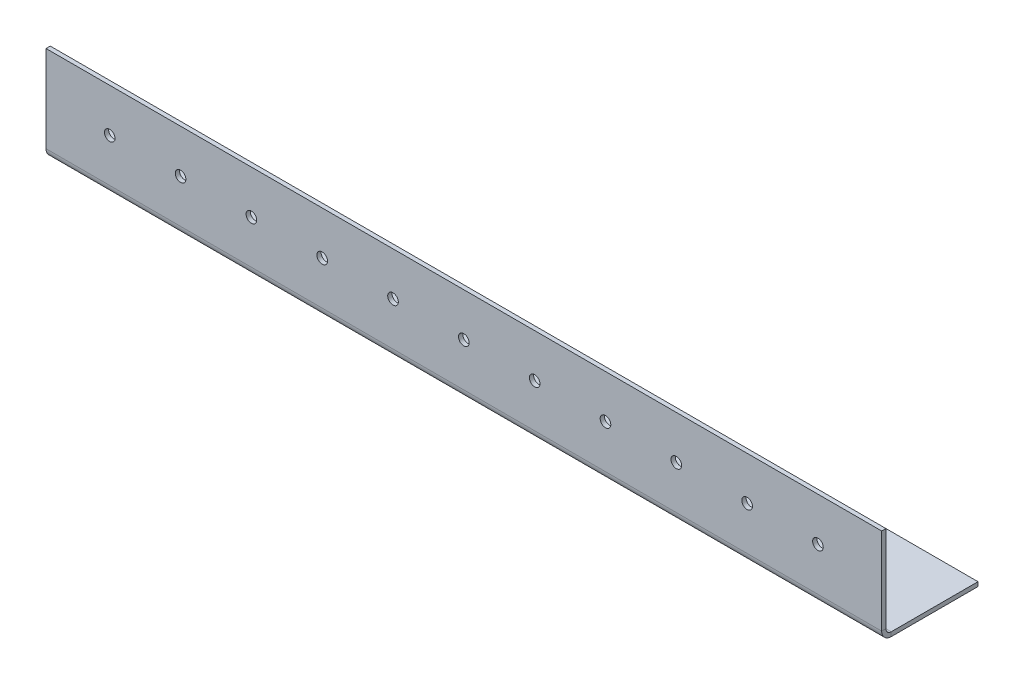
from build123d import *

# Parameters (mm, degrees)
SKETCH1_W                    = 236
SKETCH1_H                    = 26
BASE_FLANGE1_DEPTH           = 1.2
EDGE_FLANGE1_STRIP_W         = 7.8
EDGE_FLANGE1_STRIP_H         = 1.2
EDGE_FLANGE1_STRIP_CUT_DEPTH = 236
EDGE_FLANGE1_DEPTH           = 236
SKETCH9_R                    = 1.5
CUT_EXTRUDE1_DEPTH           = 10
SKETCH10_R                   = 1.5
CUT_EXTRUDE2_DEPTH           = 10


# Sheet-metal steps are written as plain solids
with BuildPart() as part:
    # Sketch1 → Base-Flange1 (new body)
    with BuildSketch(Plane(origin=(0, 0, 0), x_dir=(1, 0, 0), z_dir=(0, 1, 0))):
        with Locations((0, 13)):
            Rectangle(SKETCH1_W, SKETCH1_H)
    extrude(amount=-BASE_FLANGE1_DEPTH)

    # Edge-Flange1 strip (across the edge) → Edge-Flange1 strip cut (cut)
    with BuildSketch(Plane(origin=(-118, 0, 0), x_dir=(0, 0, -1), z_dir=(1, 0, 0))):
        with Locations((-2.4, -0.6)):
            Rectangle(EDGE_FLANGE1_STRIP_W, EDGE_FLANGE1_STRIP_H)
    extrude(amount=EDGE_FLANGE1_STRIP_CUT_DEPTH, mode=Mode.SUBTRACT)

    # Edge-Flange1 section (across the edge) → Edge-Flange1 (add)
    with BuildSketch(Plane(origin=(-118, 0, 0), x_dir=(0, 0, -1), z_dir=(1, 0, 0))):
        with BuildLine():
            Line((-1.2, 1.5), (-1.2, 26))
            Line((-1.2, 26), (0, 26))
            Line((0, 26), (0, 1.5))
            ThreePointArc((0, 1.5), (0.439339828, 0.439339828), (1.5, 0))
            Line((1.5, 0), (1.5, -1.2))
            ThreePointArc((1.5, -1.2), (-0.409188309, -0.409188309), (-1.2, 1.5))
        make_face()
    extrude(amount=EDGE_FLANGE1_DEPTH)

    # Sketch9 → Cut-Extrude1 (cut)
    with BuildSketch(Plane.XZ.offset(1.2)):
        with Locations(Location((-100, -13.75, 0), (0, 0, 270))):
            Circle(SKETCH9_R)
        with Locations(Location((-80, -13.75, 0), (0, 0, 270))):
            Circle(SKETCH9_R)
        with Locations(Location((-60, -13.75, 0), (0, 0, 270))):
            Circle(SKETCH9_R)
        with Locations(Location((-40, -13.75, 0), (0, 0, 270))):
            Circle(SKETCH9_R)
        with Locations(Location((-20, -13.75, 0), (0, 0, 270))):
            Circle(SKETCH9_R)
        with Locations(Location((0, -13.75, 0), (0, 0, 270))):
            Circle(SKETCH9_R)
        with Locations(Location((20, -13.75, 0), (0, 0, 270))):
            Circle(SKETCH9_R)
        with Locations(Location((40, -13.75, 0), (0, 0, 270))):
            Circle(SKETCH9_R)
        with Locations(Location((60, -13.75, 0), (0, 0, 270))):
            Circle(SKETCH9_R)
        with Locations(Location((80, -13.75, 0), (0, 0, 270))):
            Circle(SKETCH9_R)
        with Locations(Location((100, -13.75, 0), (0, 0, 270))):
            Circle(SKETCH9_R)
    extrude(amount=-CUT_EXTRUDE1_DEPTH, mode=Mode.SUBTRACT)

    # Sketch10 → Cut-Extrude2 (cut)
    with BuildSketch(Plane.XY.offset(1.2)):
        with Locations((-100, 13.75)):
            Circle(SKETCH10_R)
        with Locations((-80, 13.75)):
            Circle(SKETCH10_R)
        with Locations((-60, 13.75)):
            Circle(SKETCH10_R)
        with Locations((-40, 13.75)):
            Circle(SKETCH10_R)
        with Locations((-20, 13.75)):
            Circle(SKETCH10_R)
        with Locations((0, 13.75)):
            Circle(SKETCH10_R)
        with Locations((20, 13.75)):
            Circle(SKETCH10_R)
        with Locations((40, 13.75)):
            Circle(SKETCH10_R)
        with Locations((60, 13.75)):
            Circle(SKETCH10_R)
        with Locations((80, 13.75)):
            Circle(SKETCH10_R)
        with Locations((100, 13.75)):
            Circle(SKETCH10_R)
    extrude(amount=-CUT_EXTRUDE2_DEPTH, mode=Mode.SUBTRACT)


solid = part.part
